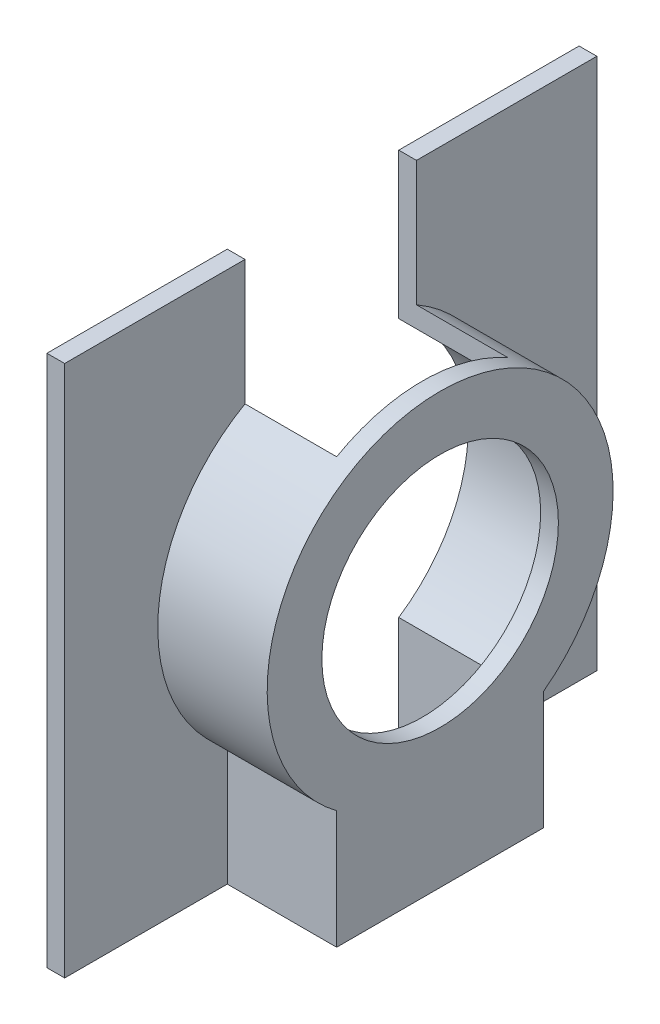
from build123d import *

# Parameters (mm, degrees)
SKETCH2_W               = 18
SKETCH2_H               = 18
BOSS_EXTRUDE1_DEPTH     = 4.3
BOSS_EXTRUDE2_DEPTH     = 3.7
SHELL2_T                = -0.6
SKETCH5_R               = 4
CUT_EXTRUDE1_DEPTH      = 16.033296378
CUT_EXTRUDE2_DEPTH      = 22.656407828
CUT_EXTRUDE2_DEPTH_BACK = 22.656407828


with BuildPart() as part:
    # Sketch2 → Boss-Extrude1 (new body)
    with BuildSketch(Plane(origin=(0, 0, 0), x_dir=(0, 0, -1), z_dir=(1, 0, 0))):
        Rectangle(SKETCH2_W, SKETCH2_H)
    extrude(amount=BOSS_EXTRUDE1_DEPTH)

    # Sketch4 → Boss-Extrude2 (add)
    with BuildSketch(Plane(origin=(4.3, 0, 0), x_dir=(0, 0, -1), z_dir=(1, 0, 0))):
        with BuildLine():
            Line((-3.5, -9), (3.5, -9))
            Line((3.5, -9), (3.5, -5))
            ThreePointArc((3.5, -5), (0, 5.537483333), (-3.5, -5))
            Line((-3.5, -5), (-3.5, -9))
        make_face()
    extrude(amount=BOSS_EXTRUDE2_DEPTH)

    # Shell2
    shell2_openings = [part.faces().sort_by_distance(p)[0] for p in [
        (0, 0, 0),
    ]]
    offset(amount=SHELL2_T, openings=shell2_openings, kind=Kind.INTERSECTION)

    # Sketch5 → Cut-Extrude1 (cut, through all)
    with BuildSketch(Plane(origin=(8, 0, 0), x_dir=(0, 0, -1), z_dir=(1, 0, 0))):
        with Locations((0, -0.312516667)):
            Circle(SKETCH5_R)
    extrude(amount=-CUT_EXTRUDE1_DEPTH, mode=Mode.SUBTRACT)

    # Sketch6 → Cut-Extrude2 (cut, two sides: drawn at the far end of the back side and taken through both)
    with BuildSketch(Plane(origin=(0, -9, 0), x_dir=(1, 0, 0), z_dir=(0, 1, 0)).offset(-CUT_EXTRUDE2_DEPTH_BACK)):
        Polygon((0, 40.044644084), (0, -8.574280431), (0, -9), (3.7, -9), (3.7, -8.4), (3.7, -2.9), (7.4, -2.9), (7.4, 2.9), (3.7, 2.9), (3.7, 8.4), (3.7, 9), (0, 9), (0, 8.4), (0, -8.4), (0, -57.018924515), (97.237849031, -57.018924515), (97.237849031, 40.044644084), align=None)
    extrude(amount=CUT_EXTRUDE2_DEPTH + CUT_EXTRUDE2_DEPTH_BACK, mode=Mode.SUBTRACT)


solid = part.part
